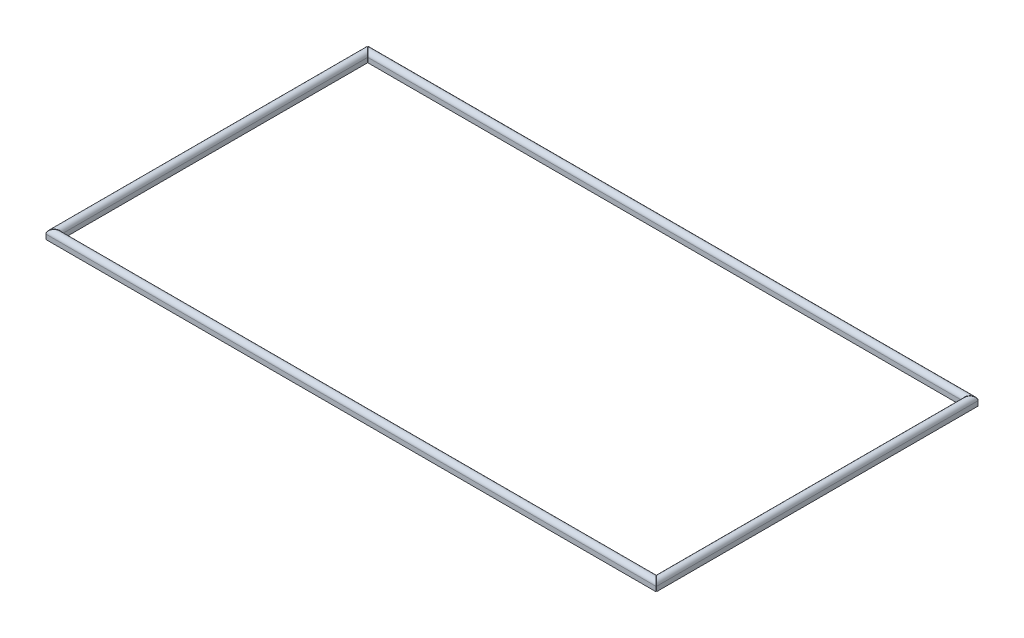
from build123d import *

# Parameters (mm, degrees)
CROQUIS1_W              = 910
CROQUIS1_H              = 12
SALIENTE_EXTRUIR1_DEPTH = 13
CORTAR_EXTRUIR1_DEPTH   = 40
REDONDEO6_R             = 6
REDONDEO7_R             = 6
REDONDEO8_R             = 6
REDONDEO9_R             = 6


with BuildPart() as part:
    # Croquis1 → Saliente-Extruir1 (new body)
    with BuildSketch(Plane(origin=(0, 0, 0), x_dir=(1, 0, 0), z_dir=(0, 1, 0))):
        Polygon((0, 480), (0, 12), (12, 12), (12, 468), (898, 468), (898, 12), (910, 12), (910, 480), align=None)
        with Locations((455, 6)):
            Rectangle(CROQUIS1_W, CROQUIS1_H)
    extrude(amount=SALIENTE_EXTRUIR1_DEPTH)

    # Croquis2 → Cortar-Extruir1 (cut)
    with BuildSketch(Plane(origin=(0, 13, 0), x_dir=(1, 0, 0), z_dir=(0, 1, 0))):
        Polygon((12, 467.5), (12, 468), (0, 480), (0, 479.5), align=None)
        Polygon((0, 480), (12, 468), (12.5, 468), (0.5, 480), align=None)
        Polygon((12, 12), (12, 12.5), (0, 0.5), (0, 0), align=None)
        Polygon((12.5, 12), (12, 12), (0, 0), (0.5, 0), align=None)
        Polygon((910, 480), (898, 468), (898, 467.5), (910, 479.5), align=None)
        Polygon((909.5, 480), (897.5, 468), (898, 468), (910, 480), align=None)
        Polygon((910, 0.5), (898, 12.5), (898, 12), (910, 0), align=None)
        Polygon((898, 12), (897.5, 12), (909.5, 0), (910, 0), align=None)
    extrude(amount=-CORTAR_EXTRUIR1_DEPTH, mode=Mode.SUBTRACT)


with BuildPart() as cortar_extruir1_piece_1:
    # of the separate pieces the step leaves, piece 1, a body of its own (cortar_extruir1_pieces)
    add(part.part.solids().sort_by_distance((909.5, 0, -480))[0])

    # Redondeo6
    redondeo6_edges = [cortar_extruir1_piece_1.edges().sort_by_distance(p)[0] for p in [
        (455, 13, -480),
        (455, 13, -468),
    ]]
    fillet(redondeo6_edges, radius=REDONDEO6_R - 0.0001)  # a hair under: the kernel refuses the full size


with BuildPart() as cortar_extruir1_piece_2:
    # of the separate pieces the step leaves, piece 2, a body of its own (cortar_extruir1_pieces)
    add(part.part.solids().sort_by_distance((0.5, 0, 0))[0])

    # Redondeo8
    redondeo8_edges = [cortar_extruir1_piece_2.edges().sort_by_distance(p)[0] for p in [
        (455, 13, 0),
        (455, 13, -12),
    ]]
    fillet(redondeo8_edges, radius=REDONDEO8_R - 0.0001)  # a hair under: the kernel refuses the full size


with BuildPart() as cortar_extruir1_piece_3:
    # of the separate pieces the step leaves, piece 3, a body of its own (cortar_extruir1_pieces)
    add(part.part.solids().sort_by_distance((0, 0, -479.5))[0])

    # Redondeo7
    redondeo7_edges = [cortar_extruir1_piece_3.edges().sort_by_distance(p)[0] for p in [
        (0, 13, -240),
        (12, 13, -240),
    ]]
    fillet(redondeo7_edges, radius=REDONDEO7_R - 0.0001)  # a hair under: the kernel refuses the full size


with BuildPart() as cortar_extruir1_piece_4:
    # of the separate pieces the step leaves, piece 4, a body of its own (cortar_extruir1_pieces)
    add(part.part.solids().sort_by_distance((910, 0, -479.5))[0])

    # Redondeo9
    redondeo9_edges = [cortar_extruir1_piece_4.edges().sort_by_distance(p)[0] for p in [
        (910, 13, -240),
        (898, 13, -240),
    ]]
    fillet(redondeo9_edges, radius=REDONDEO9_R - 0.0001)  # a hair under: the kernel refuses the full size


solid = Compound([cortar_extruir1_piece_1.part, cortar_extruir1_piece_2.part, cortar_extruir1_piece_3.part, cortar_extruir1_piece_4.part])
